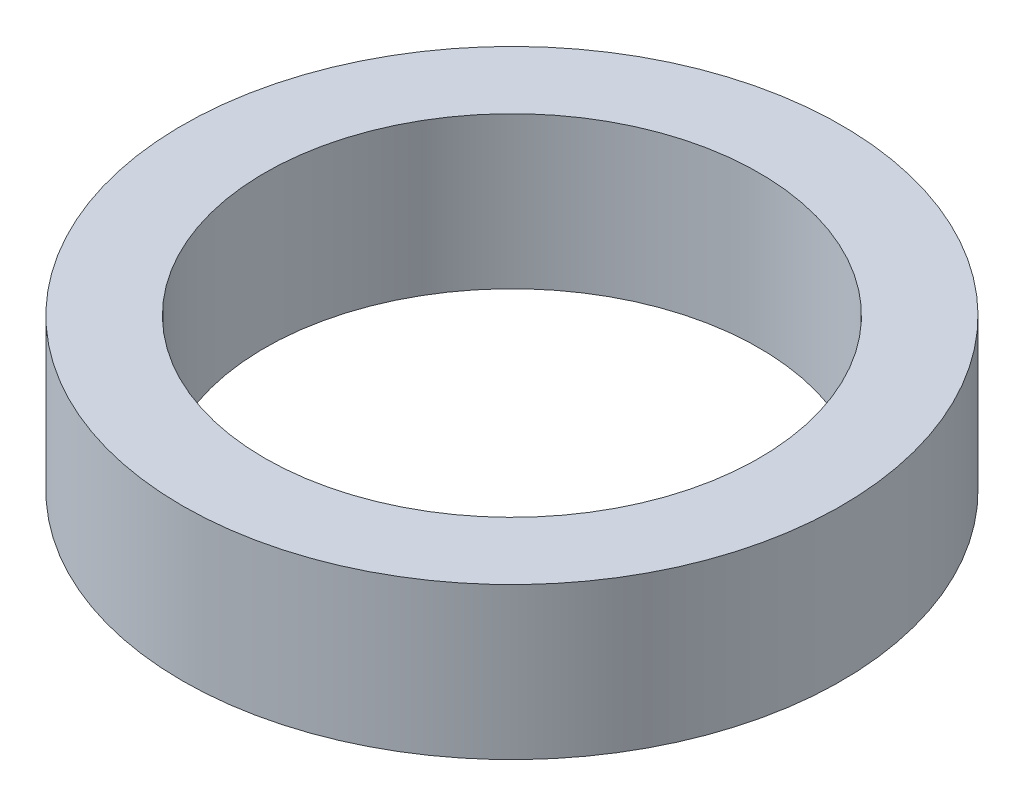
from build123d import *

# Parameters (mm, degrees)
SKETCH1_R           = 50
BOSS_EXTRUDE1_DEPTH = 23
SKETCH2_R           = 37.5
CUT_EXTRUDE1_DEPTH  = 75.35724578


with BuildPart() as part:
    # Sketch1 → Boss-Extrude1 (new body)
    with BuildSketch(Plane(origin=(0, 0, 0), x_dir=(1, 0, 0), z_dir=(0, 1, 0))):
        Circle(SKETCH1_R)
    extrude(amount=BOSS_EXTRUDE1_DEPTH)

    # Sketch2 → Cut-Extrude1 (cut, through all)
    with BuildSketch(Plane(origin=(0, 0, 0), x_dir=(1, 0, 0), z_dir=(0, 1, 0))):
        Circle(SKETCH2_R)
    extrude(amount=CUT_EXTRUDE1_DEPTH, mode=Mode.SUBTRACT)


solid = part.part
